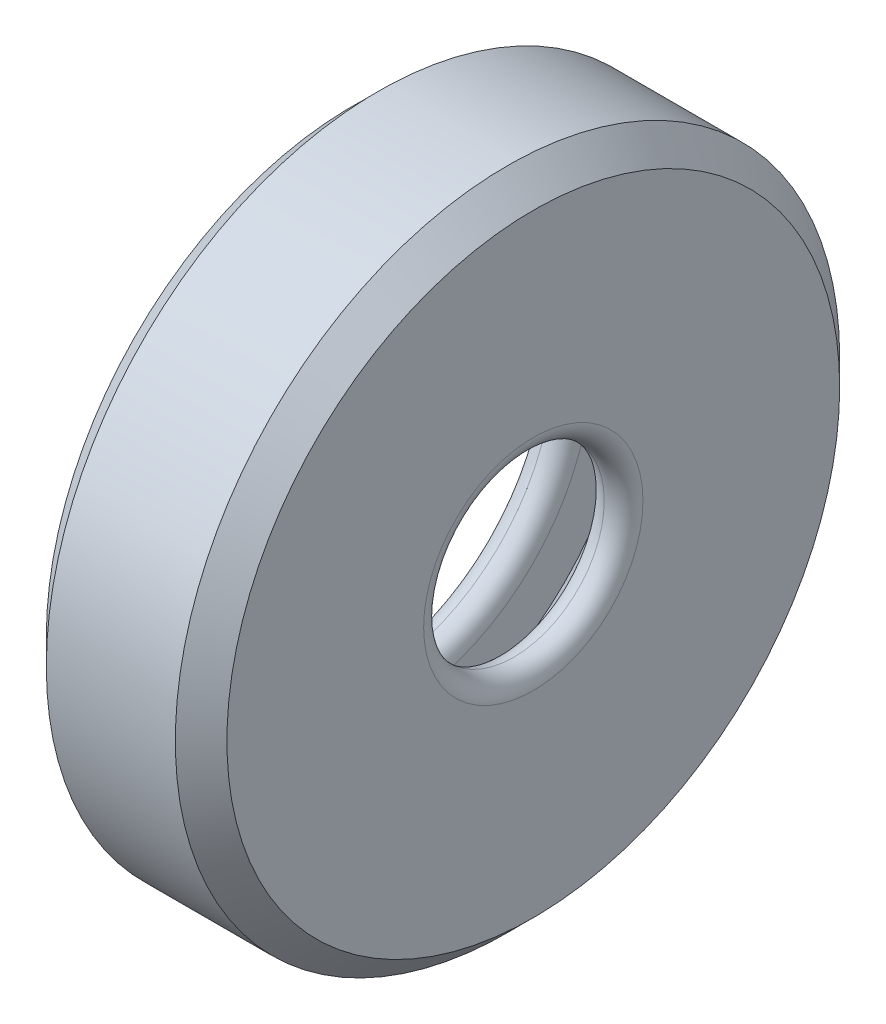
from build123d import *

# Parameters (mm, degrees)
CHAMFER1_SIZE = 2
FILLET1_R     = 1.5


with BuildPart() as part:
    # Sketch1 → Revolve1 (revolve)
    with BuildSketch(Plane.XY, mode=Mode.PRIVATE) as revolve1_sk:
        Polygon((-7, 14), (-7, 25.75), (7, 25.75), (7, 14), (7, 7), (4, 7), (4, 14), (4, 21), (-4, 21), (-4, 14), align=None)
    revolve(revolve1_sk.sketch.rotate(Axis((0, 0, 0), (-1, 0, 0)), 90), axis=Axis((0, 0, 0), (-1, 0, 0)))

    # Chamfer1
    chamfer1_edges = [part.edges().sort_by_distance(p)[0] for p in [
        (7, 0, 25.75),
        (-7, 0, 25.75),
        (-4, 0, 21),
        (4, 0, 21),
    ]]
    chamfer(chamfer1_edges, length=CHAMFER1_SIZE)

    # Fillet1
    fillet1_edges = [part.edges().sort_by_distance(p)[0] for p in [
        (7, 0, 7),
        (-7, 0, 14),
        (-4, 0, 14),
        (4, 0, 7),
    ]]
    fillet(fillet1_edges, radius=FILLET1_R - 0.0001)  # a hair under: the kernel refuses the full size


solid = part.part
